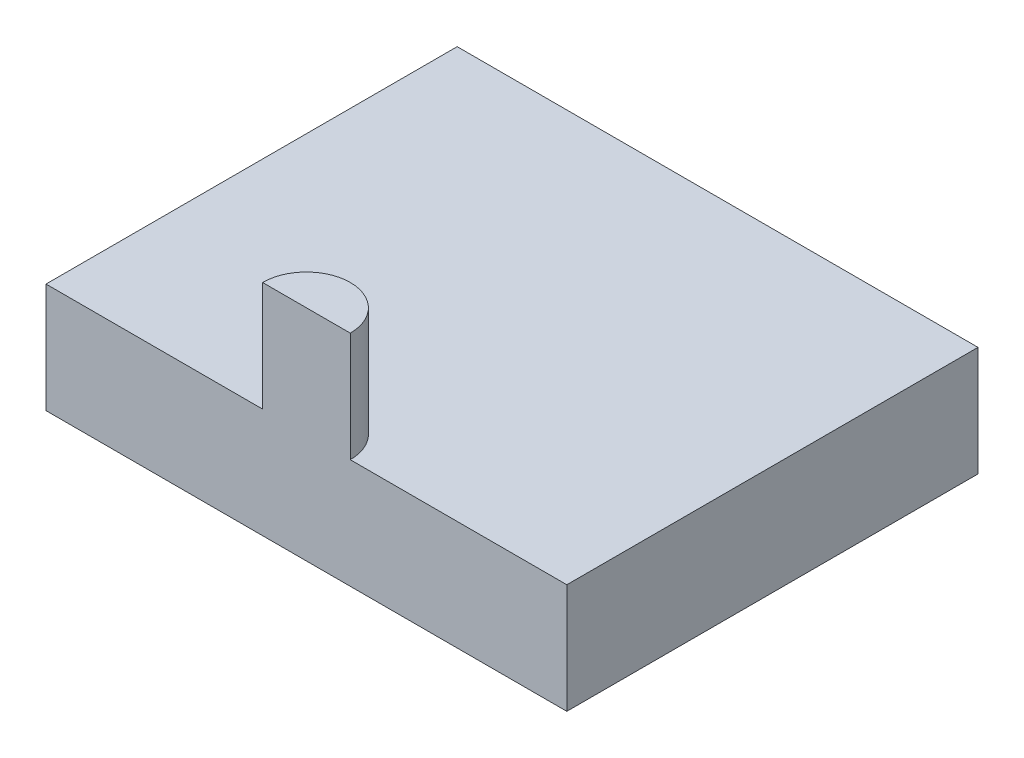
from build123d import *

# Parameters (mm, degrees)
SKETCH1_W           = 95
SKETCH1_H           = 75
BOSS_EXTRUDE1_DEPTH = 10
SKETCH2_W           = 8
SKETCH2_H           = 20
REVOLVE1_ANGLE      = 180


with BuildPart() as part:
    # Sketch1 → Boss-Extrude1 (new, symmetric)
    with BuildSketch(Plane(origin=(0, 0, 0), x_dir=(1, 0, 0), z_dir=(0, 1, 0))):
        Rectangle(SKETCH1_W, SKETCH1_H)
    extrude(amount=BOSS_EXTRUDE1_DEPTH, both=True)

    # Sketch2 → Revolve1 (revolve)
    with BuildSketch(Plane.XY.offset(37.5)):
        with Locations((-4, 20)):
            Rectangle(SKETCH2_W, SKETCH2_H)
    revolve(axis=Axis((0, 10, 37.5), (0, -1, 0)), revolution_arc=REVOLVE1_ANGLE)


solid = part.part
